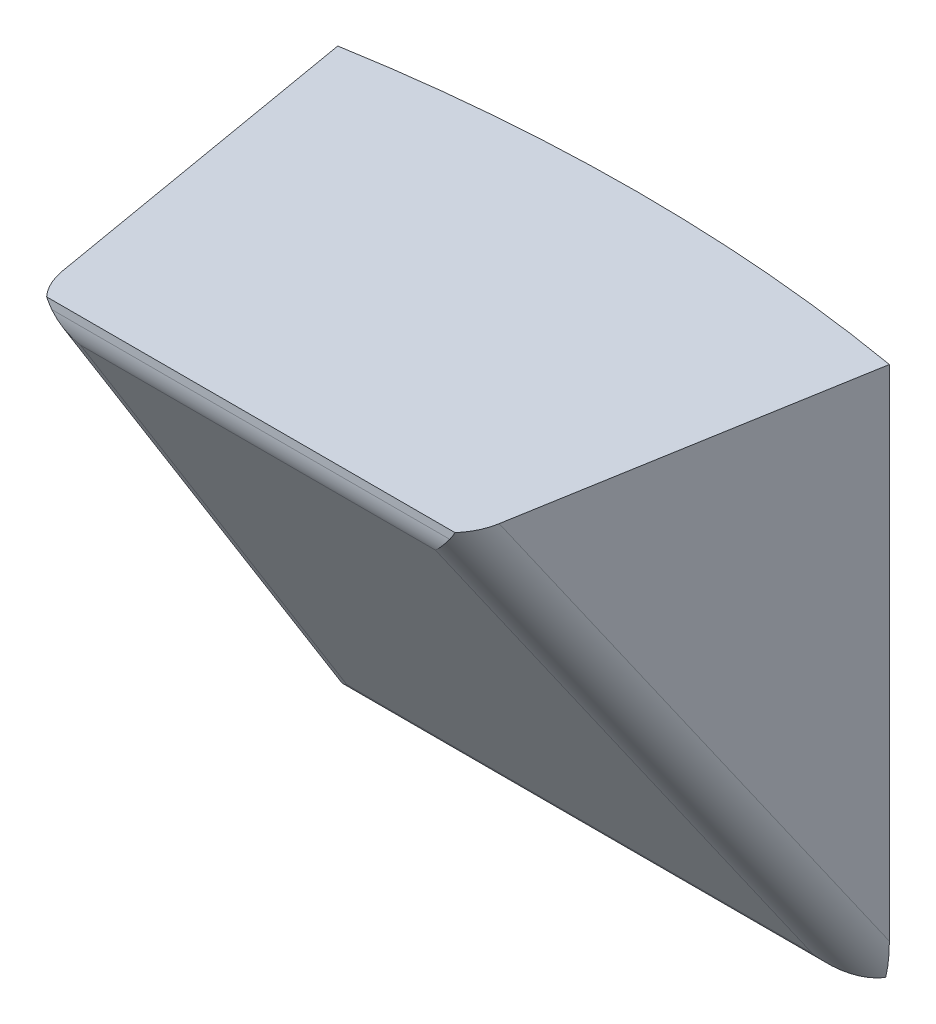
from build123d import *

# Parameters (mm, degrees)
BOSS_EXTRUDE1_DEPTH     = 31.75
CUT_EXTRUDE1_DEPTH      = 104.222934041
CUT_EXTRUDE1_DEPTH_BACK = 104.222934041
FILLET1_R               = 2.54


with BuildPart() as part:
    # Sketch1 → Boss-Extrude1 (new body)
    with BuildSketch(Plane(origin=(0, 0, 0), x_dir=(1, 0, 0), z_dir=(0, 1, 0))):
        with BuildLine():
            Line((-12.7, 73.846320133), (12.7, 73.846320133))
            Line((12.7, 73.846320133), (16.413720047, 95.436320133))
            ThreePointArc((16.413720047, 95.436320133), (0, 96.8375), (-16.413720047, 95.436320133))
            Line((-16.413720047, 95.436320133), (-12.7, 73.846320133))
        make_face()
    extrude(amount=BOSS_EXTRUDE1_DEPTH)

    # Sketch2 → Cut-Extrude1 (cut, two sides: drawn at the far end of the back side and taken through both)
    with BuildSketch(Plane(origin=(0, 0, 0), x_dir=(0, 0, -1), z_dir=(1, 0, 0)).offset(-CUT_EXTRUDE1_DEPTH_BACK)):
        Polygon((73.846320133, 30.48), (94.166320133, 0), (73.846320133, 0), align=None)
    extrude(amount=CUT_EXTRUDE1_DEPTH + CUT_EXTRUDE1_DEPTH_BACK, mode=Mode.SUBTRACT)

    # Fillet1
    # the kernel refuses this fillet: 2.54 mm, written as the material it takes off along each edge
    with BuildSketch(Plane(origin=(12.176698441, 35.043381397, -70.804065868), x_dir=(-0.9954788736987198, -0.07903081588642236, -0.05268721059094609), z_dir=(0.09498321967341544, -0.8282884898681249, -0.5521923265787502))) as fillet1_piece_1:
        with BuildLine():
            CenterArc((FILLET1_R * 0.867623718674, FILLET1_R), FILLET1_R, 188.108634364, 81.891365636)
            Line((-FILLET1_R * 0.122378694256, FILLET1_R * 0.858949575003), (0, 0))
            Line((0, 0), (FILLET1_R * 0.867623718674, 0))
        make_face()
    extrude(amount=47.817594086, mode=Mode.SUBTRACT)
    with BuildSketch(Plane(origin=(-16.718567485, -4.563381397, -97.208574398), x_dir=(-0.14041271821062315, 0.5603018628846251, -0.8163002456282387), z_dir=(0.09498321967341593, 0.8282884898681249, 0.5521923265787501))) as fillet1_piece_2:
        with BuildLine():
            CenterArc((FILLET1_R * 0.867623718674, -FILLET1_R), FILLET1_R, 90, 81.891365636)
            Line((-FILLET1_R * 0.122378694256, -FILLET1_R * 0.858949575003), (0, 0))
            Line((0, 0), (FILLET1_R * 0.867623718674, 0))
        make_face()
    extrude(amount=47.817594086, mode=Mode.SUBTRACT)
    with BuildSketch(Plane(origin=(19.593682793, 0, -94.166320133), x_dir=(0, 0, -1), z_dir=(-1, 0, 0))) as fillet1_piece_3:
        with BuildLine():
            CenterArc((FILLET1_R * 0.535183758488, -FILLET1_R), FILLET1_R, 90, 56.309932474)
            Line((-FILLET1_R * 0.29686653585, -FILLET1_R * 0.445299803775), (0, 0))
            Line((0, 0), (FILLET1_R * 0.535183758488, 0))
        make_face()
    extrude(amount=39.187365585, mode=Mode.SUBTRACT)
    with BuildSketch(Plane(origin=(-14.6226253, 30.48, -73.846320133), x_dir=(0, -0.8320502943378437, -0.5547001962252291), z_dir=(1, 0, 0))) as fillet1_piece_4:
        with BuildLine():
            CenterArc((FILLET1_R * 0.302775637732, FILLET1_R), FILLET1_R, 236.309932474, 33.690067526)
            Line((-FILLET1_R * 0.251924558493, FILLET1_R * 0.167949705662), (0, 0))
            Line((0, 0), (FILLET1_R * 0.302775637732, 0))
        make_face()
    extrude(amount=29.245250599, mode=Mode.SUBTRACT)


solid = part.part
